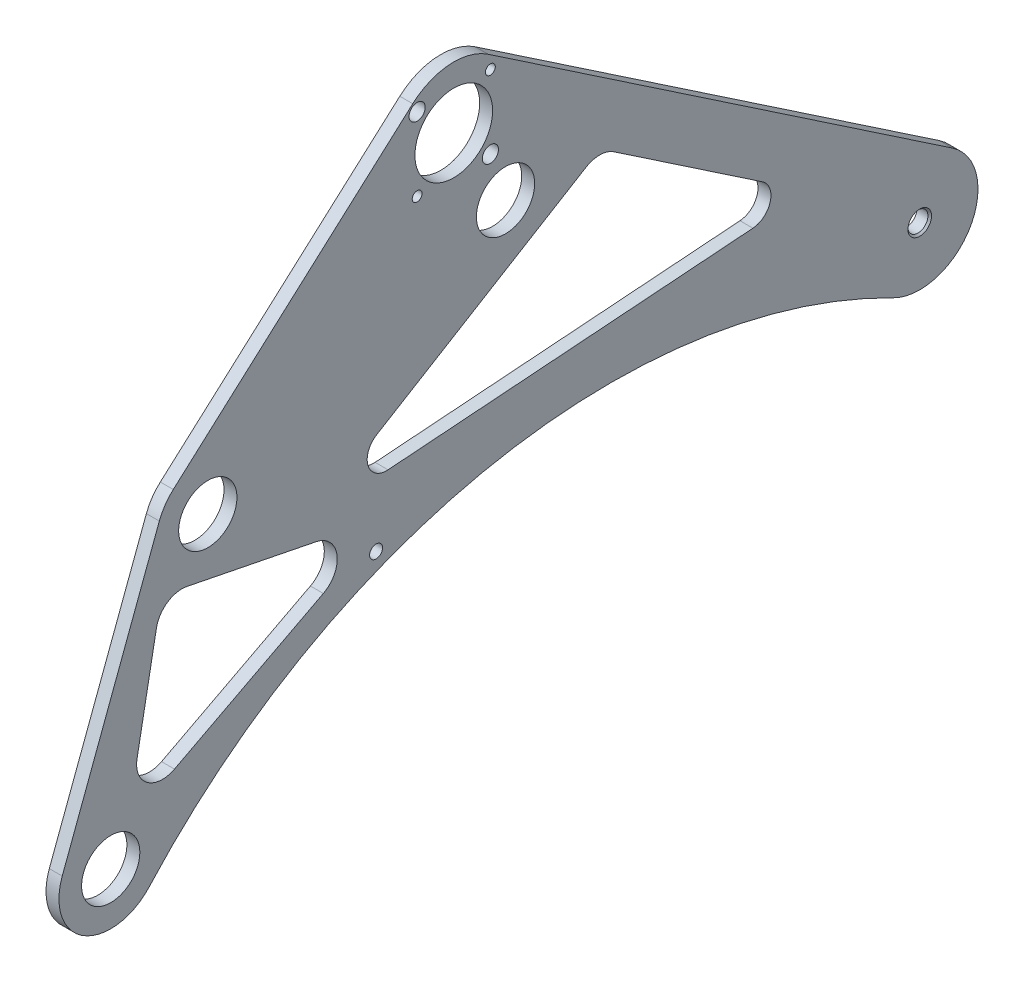
from build123d import *

# Parameters (mm, degrees)
BOSS_EXTRUDE1_DEPTH               = 6.35
CUT_EXTRUDE1_REACH                = 462.093
SKETCH3_R                         = 14.2875
SKETCH3_R_2                       = 19.05
SKETCH3_R_3                       = 2.413
SKETCH3_R_4                       = 3.96875
F_3_8_CLEARANCE_HOLE2_D           = 9.8044
F_3_8_CLEARANCE_HOLE2_CSINK_D     = 11.58748
F_3_8_CLEARANCE_HOLE2_CSINK_ANGLE = 90
F_1_4_0_2500_DOWEL_HOLE2_D        = 6.35
CUT_EXTRUDE2_DEPTH                = 461.092995525


with BuildPart() as part:
    # Sketch2 → Boss-Extrude1 (new body)
    with BuildSketch(Plane(origin=(0, 0, 0), x_dir=(0, 0, -1), z_dir=(1, 0, 0))):
        with BuildLine():
            Line((-420.65776111, -67.281464584), (-373.03276111, 59.718535416))
            ThreePointArc((-373.03276111, 59.718535416), (-370.217283815, 65.136422477), (-366.190217158, 69.725882876))
            Line((-366.190217158, 69.725882876), (-248.716507876, 174.874485915))
            ThreePointArc((-248.716507876, 174.874485915), (-230.65414247, 182.492472563), (-211.724122614, 177.399623371))
            Line((-211.724122614, 177.399623371), (15.987673313, 23.68385372))
            ThreePointArc((15.987673313, 23.68385372), (24.617664495, -14.508660165), (-12.975284095, -25.459234624))
            ThreePointArc((-12.975284095, -25.459234624), (-206.983757432, 2.660555148), (-377.990639572, -93.186492612))
            ThreePointArc((-377.990639572, -93.186492612), (-410.057040874, -97.911605155), (-420.65776111, -67.281464584))
        make_face()
    extrude(amount=BOSS_EXTRUDE1_DEPTH)

    # Sketch3 → Cut-Extrude1 (cut, up to next)
    with BuildSketch(Plane(origin=(6.35, 0, 0), x_dir=(0, 0, -1), z_dir=(1, 0, 0)), mode=Mode.PRIVATE) as cut_extrude1_sk1:
        with Locations((-203.2, 111.125)):
            Circle(SKETCH3_R)
    cut_extrude1_tool1 = extrude(cut_extrude1_sk1.sketch, amount=-CUT_EXTRUDE1_REACH, mode=Mode.PRIVATE) & part.part
    # Sketch3 → Cut-Extrude1 (cut, up to next)
    with BuildSketch(Plane(origin=(6.35, 0, 0), x_dir=(0, 0, -1), z_dir=(1, 0, 0)), mode=Mode.PRIVATE) as cut_extrude1_sk2:
        with Locations((-349.25, 50.8)):
            Circle(SKETCH3_R)
    cut_extrude1_tool2 = extrude(cut_extrude1_sk2.sketch, amount=-CUT_EXTRUDE1_REACH, mode=Mode.PRIVATE) & part.part
    # Sketch3 → Cut-Extrude1 (cut, up to next)
    with BuildSketch(Plane(origin=(6.35, 0, 0), x_dir=(0, 0, -1), z_dir=(1, 0, 0)), mode=Mode.PRIVATE) as cut_extrude1_sk3:
        with Locations((-396.875, -76.2)):
            Circle(SKETCH3_R)
    cut_extrude1_tool3 = extrude(cut_extrude1_sk3.sketch, amount=-CUT_EXTRUDE1_REACH, mode=Mode.PRIVATE) & part.part
    # Sketch3 → Cut-Extrude1 (cut, up to next)
    with BuildSketch(Plane(origin=(6.35, 0, 0), x_dir=(0, 0, -1), z_dir=(1, 0, 0)), mode=Mode.PRIVATE) as cut_extrude1_sk4:
        with Locations((-228.6, 152.4)):
            Circle(SKETCH3_R_2)
    cut_extrude1_tool4 = extrude(cut_extrude1_sk4.sketch, amount=-CUT_EXTRUDE1_REACH, mode=Mode.PRIVATE) & part.part
    # Sketch3 → Cut-Extrude1 (cut, up to next)
    with BuildSketch(Plane(origin=(6.35, 0, 0), x_dir=(0, 0, -1), z_dir=(1, 0, 0)), mode=Mode.PRIVATE) as cut_extrude1_sk5:
        with Locations((-246.560512242, 134.439487758)):
            Circle(SKETCH3_R_3)
    cut_extrude1_tool5 = extrude(cut_extrude1_sk5.sketch, amount=-CUT_EXTRUDE1_REACH, mode=Mode.PRIVATE) & part.part
    # Sketch3 → Cut-Extrude1 (cut, up to next)
    with BuildSketch(Plane(origin=(6.35, 0, 0), x_dir=(0, 0, -1), z_dir=(1, 0, 0)), mode=Mode.PRIVATE) as cut_extrude1_sk6:
        with Locations((-210.639487758, 134.439487758)):
            Circle(SKETCH3_R_4)
    cut_extrude1_tool6 = extrude(cut_extrude1_sk6.sketch, amount=-CUT_EXTRUDE1_REACH, mode=Mode.PRIVATE) & part.part
    # Sketch3 → Cut-Extrude1 (cut, up to next)
    with BuildSketch(Plane(origin=(6.35, 0, 0), x_dir=(0, 0, -1), z_dir=(1, 0, 0)), mode=Mode.PRIVATE) as cut_extrude1_sk7:
        with Locations((-210.639487758, 170.360512242)):
            Circle(SKETCH3_R_3)
    cut_extrude1_tool7 = extrude(cut_extrude1_sk7.sketch, amount=-CUT_EXTRUDE1_REACH, mode=Mode.PRIVATE) & part.part
    # Sketch3 → Cut-Extrude1 (cut, up to next)
    with BuildSketch(Plane(origin=(6.35, 0, 0), x_dir=(0, 0, -1), z_dir=(1, 0, 0)), mode=Mode.PRIVATE) as cut_extrude1_sk8:
        with Locations((-246.560512242, 170.360512242)):
            Circle(SKETCH3_R_4)
    cut_extrude1_tool8 = extrude(cut_extrude1_sk8.sketch, amount=-CUT_EXTRUDE1_REACH, mode=Mode.PRIVATE) & part.part
    add(cut_extrude1_tool1.solids().sort_by_distance((6.35, 111.125, 203.2))[0], mode=Mode.SUBTRACT)
    add(cut_extrude1_tool2.solids().sort_by_distance((6.35, 50.8, 349.25))[0], mode=Mode.SUBTRACT)
    add(cut_extrude1_tool3.solids().sort_by_distance((6.35, -76.2, 396.875))[0], mode=Mode.SUBTRACT)
    add(cut_extrude1_tool4.solids().sort_by_distance((6.35, 152.4, 228.6))[0], mode=Mode.SUBTRACT)
    add(cut_extrude1_tool5.solids().sort_by_distance((6.35, 134.439488, 246.560512))[0], mode=Mode.SUBTRACT)
    add(cut_extrude1_tool6.solids().sort_by_distance((6.35, 134.439488, 210.639488))[0], mode=Mode.SUBTRACT)
    add(cut_extrude1_tool7.solids().sort_by_distance((6.35, 170.360512, 210.639488))[0], mode=Mode.SUBTRACT)
    add(cut_extrude1_tool8.solids().sort_by_distance((6.35, 170.360512, 246.560512))[0], mode=Mode.SUBTRACT)

    # 3/8 Clearance Hole2 (through all)
    with Locations(Plane(origin=(6.35, 0, 0), x_dir=(0, 0, -1), z_dir=(1, 0, 0))):
        with Locations((0, 0)):
            CounterSinkHole(F_3_8_CLEARANCE_HOLE2_D / 2, F_3_8_CLEARANCE_HOLE2_CSINK_D / 2, counter_sink_angle=F_3_8_CLEARANCE_HOLE2_CSINK_ANGLE)

    # 1/4 (0.2500) Dowel Hole2 (through all)
    with Locations(Plane(origin=(6.35, 0, 0), x_dir=(0, 0, -1), z_dir=(1, 0, 0))):
        with Locations((-266.7, -6.35)):
            Hole(F_1_4_0_2500_DOWEL_HOLE2_D / 2)

    # Sketch14 → Cut-Extrude2 (cut, through all)
    with BuildSketch(Plane(origin=(6.35, 0, 0), x_dir=(0, 0, -1), z_dir=(1, 0, 0))):
        with BuildLine():
            Line((-365.600411715, -49.359627546), (-292.575411715, -11.259627546))
            ThreePointArc((-292.575411715, -11.259627546), (-285.877370021, 1.794150333), (-295.959325084, 12.453374581))
            Line((-295.959325084, 12.453374581), (-359.459325084, 25.153374581))
            ThreePointArc((-359.459325084, 25.153374581), (-369.058218075, 23.224411423), (-374.432476774, 15.040464395))
            Line((-374.432476774, 15.040464395), (-383.957476774, -35.759535605))
            ThreePointArc((-383.957476774, -35.759535605), (-379.035203223, -48.304573838), (-365.600411715, -49.359627546))
        make_face()
        with BuildLine():
            Line((-77.20752162, 55.949267111), (-149.968519497, 105.066234213))
            ThreePointArc((-149.968519497, 105.066234213), (-156.765517001, 107.236326229), (-163.659929975, 105.39906082))
            Line((-163.659929975, 105.39906082), (-266.47492871, 43.043617869))
            ThreePointArc((-266.47492871, 43.043617869), (-270.608700361, 32.000347521), (-260.837451688, 25.4))
            Line((-260.837451688, 25.4), (-81.838602457, 38.555269198))
            ThreePointArc((-81.838602457, 38.555269198), (-73.332394792, 45.604028308), (-77.20752162, 55.949267111))
        make_face()
    extrude(amount=-CUT_EXTRUDE2_DEPTH, mode=Mode.SUBTRACT)


solid = part.part
